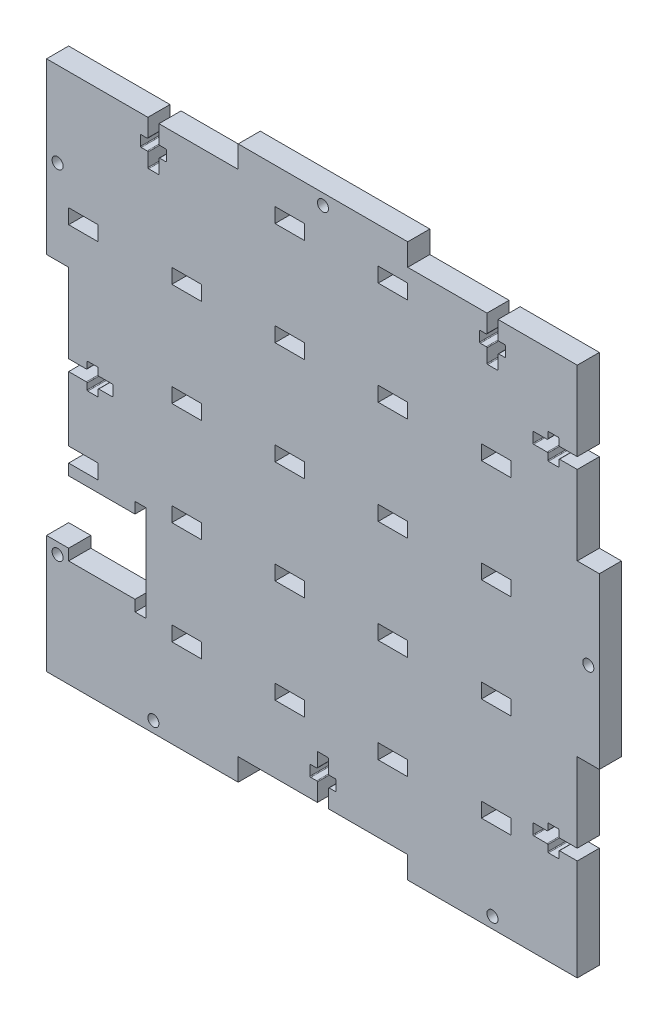
from build123d import *

# Parameters (mm, degrees)
BOX_SIDE_DEPTH       = 6
SKETCH2_R            = 1.5
SCREW_CUT_OUTS_DEPTH = 107.235587258
CUT_EXTRUDE1_DEPTH   = 107.235587258
SKETCH4_W            = 8
SKETCH4_H            = 4
CUT_EXTRUDE2_DEPTH   = 107.235587258


with BuildPart() as part:
    # Sketch1 → Box Side (new body)
    with BuildSketch(Plane.XY):
        Polygon((-69, 69), (-23, 69), (-23, 75), (23, 75), (23, 69), (69, 69), (69, 23), (75, 23), (75, -23), (69, -23), (69, -69), (69, -75), (23, -75), (23, -69), (-23, -69), (-23, -75), (-69, -75), (-75, -75), (-75, -69), (-75, -23), (-69, -23), (-69, 23), (-75, 23), (-75, 69), align=None)
    extrude(amount=BOX_SIDE_DEPTH)

    # Sketch2 → Screw Cut-outs (cut, through all)
    with BuildSketch(Plane.XY.offset(6)):
        with Locations((0, 72)):
            Circle(SKETCH2_R)
        with Locations((72, 0)):
            Circle(SKETCH2_R)
        with Locations((-46, -72)):
            Circle(SKETCH2_R)
        with Locations((46, -72)):
            Circle(SKETCH2_R)
        with Locations((-72, 46)):
            Circle(SKETCH2_R)
        with Locations((-72, -46)):
            Circle(SKETCH2_R)
        with BuildLine():
            Line((-44.5, 69), (-44.5, 64.2))
            ThreePointArc((-44.5, 64.2), (-44.441421356, 64.058578644), (-44.3, 64))
            Line((-44.3, 64), (-42.7, 64))
            ThreePointArc((-42.7, 64), (-42.558578644, 63.941421356), (-42.5, 63.8))
            Line((-42.5, 63.8), (-42.5, 61.2))
            ThreePointArc((-42.5, 61.2), (-42.558578644, 61.058578644), (-42.7, 61))
            Line((-42.7, 61), (-44.3, 61))
            ThreePointArc((-44.3, 61), (-44.441421356, 60.941421356), (-44.5, 60.8))
            Line((-44.5, 60.8), (-44.5, 57.2))
            ThreePointArc((-44.5, 57.2), (-44.558578644, 57.058578644), (-44.7, 57))
            Line((-44.7, 57), (-47.3, 57))
            ThreePointArc((-47.3, 57), (-47.441421356, 57.058578644), (-47.5, 57.2))
            Line((-47.5, 57.2), (-47.5, 60.8))
            ThreePointArc((-47.5, 60.8), (-47.558578644, 60.941421356), (-47.7, 61))
            Line((-47.7, 61), (-49.3, 61))
            ThreePointArc((-49.3, 61), (-49.441421356, 61.058578644), (-49.5, 61.2))
            Line((-49.5, 61.2), (-49.5, 63.8))
            ThreePointArc((-49.5, 63.8), (-49.441421356, 63.941421356), (-49.3, 64))
            Line((-49.3, 64), (-47.7, 64))
            ThreePointArc((-47.7, 64), (-47.558578644, 64.058578644), (-47.5, 64.2))
            Line((-47.5, 64.2), (-47.5, 69))
            Line((-47.5, 69), (-44.5, 69))
        make_face()
        with BuildLine():
            Line((47.5, 69), (47.5, 64.2))
            ThreePointArc((47.5, 64.2), (47.558578644, 64.058578644), (47.7, 64))
            Line((47.7, 64), (49.3, 64))
            ThreePointArc((49.3, 64), (49.441421356, 63.941421356), (49.5, 63.8))
            Line((49.5, 63.8), (49.5, 61.2))
            ThreePointArc((49.5, 61.2), (49.441421356, 61.058578644), (49.3, 61))
            Line((49.3, 61), (47.7, 61))
            ThreePointArc((47.7, 61), (47.558578644, 60.941421356), (47.5, 60.8))
            Line((47.5, 60.8), (47.5, 57.2))
            ThreePointArc((47.5, 57.2), (47.441421356, 57.058578644), (47.3, 57))
            Line((47.3, 57), (44.7, 57))
            ThreePointArc((44.7, 57), (44.558578644, 57.058578644), (44.5, 57.2))
            Line((44.5, 57.2), (44.5, 60.8))
            ThreePointArc((44.5, 60.8), (44.441421356, 60.941421356), (44.3, 61))
            Line((44.3, 61), (42.7, 61))
            ThreePointArc((42.7, 61), (42.558578644, 61.058578644), (42.5, 61.2))
            Line((42.5, 61.2), (42.5, 63.8))
            ThreePointArc((42.5, 63.8), (42.558578644, 63.941421356), (42.7, 64))
            Line((42.7, 64), (44.3, 64))
            ThreePointArc((44.3, 64), (44.441421356, 64.058578644), (44.5, 64.2))
            Line((44.5, 64.2), (44.5, 69))
            Line((44.5, 69), (47.5, 69))
        make_face()
        with BuildLine():
            Line((69, 44.5), (64.2, 44.5))
            ThreePointArc((64.2, 44.5), (64.058578644, 44.441421356), (64, 44.3))
            Line((64, 44.3), (64, 42.7))
            ThreePointArc((64, 42.7), (63.941421356, 42.558578644), (63.8, 42.5))
            Line((63.8, 42.5), (61.2, 42.5))
            ThreePointArc((61.2, 42.5), (61.058578644, 42.558578644), (61, 42.7))
            Line((61, 42.7), (61, 44.3))
            ThreePointArc((61, 44.3), (60.941421356, 44.441421356), (60.8, 44.5))
            Line((60.8, 44.5), (57.2, 44.5))
            ThreePointArc((57.2, 44.5), (57.058578644, 44.558578644), (57, 44.7))
            Line((57, 44.7), (57, 47.3))
            ThreePointArc((57, 47.3), (57.058578644, 47.441421356), (57.2, 47.5))
            Line((57.2, 47.5), (60.8, 47.5))
            ThreePointArc((60.8, 47.5), (60.941421356, 47.558578644), (61, 47.7))
            Line((61, 47.7), (61, 49.3))
            ThreePointArc((61, 49.3), (61.058578644, 49.441421356), (61.2, 49.5))
            Line((61.2, 49.5), (63.8, 49.5))
            ThreePointArc((63.8, 49.5), (63.941421356, 49.441421356), (64, 49.3))
            Line((64, 49.3), (64, 47.7))
            ThreePointArc((64, 47.7), (64.058578644, 47.558578644), (64.2, 47.5))
            Line((64.2, 47.5), (69, 47.5))
            Line((69, 47.5), (69, 44.5))
        make_face()
        with BuildLine():
            Line((69, -47.5), (64.2, -47.5))
            ThreePointArc((64.2, -47.5), (64.058578644, -47.558578644), (64, -47.7))
            Line((64, -47.7), (64, -49.3))
            ThreePointArc((64, -49.3), (63.941421356, -49.441421356), (63.8, -49.5))
            Line((63.8, -49.5), (61.2, -49.5))
            ThreePointArc((61.2, -49.5), (61.058578644, -49.441421356), (61, -49.3))
            Line((61, -49.3), (61, -47.7))
            ThreePointArc((61, -47.7), (60.941421356, -47.558578644), (60.8, -47.5))
            Line((60.8, -47.5), (57.2, -47.5))
            ThreePointArc((57.2, -47.5), (57.058578644, -47.441421356), (57, -47.3))
            Line((57, -47.3), (57, -44.7))
            ThreePointArc((57, -44.7), (57.058578644, -44.558578644), (57.2, -44.5))
            Line((57.2, -44.5), (60.8, -44.5))
            ThreePointArc((60.8, -44.5), (60.941421356, -44.441421356), (61, -44.3))
            Line((61, -44.3), (61, -42.7))
            ThreePointArc((61, -42.7), (61.058578644, -42.558578644), (61.2, -42.5))
            Line((61.2, -42.5), (63.8, -42.5))
            ThreePointArc((63.8, -42.5), (63.941421356, -42.558578644), (64, -42.7))
            Line((64, -42.7), (64, -44.3))
            ThreePointArc((64, -44.3), (64.058578644, -44.441421356), (64.2, -44.5))
            Line((64.2, -44.5), (69, -44.5))
            Line((69, -44.5), (69, -47.5))
        make_face()
        with BuildLine():
            Line((-1.5, -69), (1.5, -69))
            Line((1.5, -69), (1.5, -64.2))
            ThreePointArc((1.5, -64.2), (1.558578644, -64.058578644), (1.7, -64))
            Line((1.7, -64), (3.3, -64))
            ThreePointArc((3.3, -64), (3.441421356, -63.941421356), (3.5, -63.8))
            Line((3.5, -63.8), (3.5, -61.2))
            ThreePointArc((3.5, -61.2), (3.441421356, -61.058578644), (3.3, -61))
            Line((3.3, -61), (1.7, -61))
            ThreePointArc((1.7, -61), (1.558578644, -60.941421356), (1.5, -60.8))
            Line((1.5, -60.8), (1.5, -57.2))
            ThreePointArc((1.5, -57.2), (1.441421356, -57.058578644), (1.3, -57))
            Line((1.3, -57), (-1.3, -57))
            ThreePointArc((-1.3, -57), (-1.441421356, -57.058578644), (-1.5, -57.2))
            Line((-1.5, -57.2), (-1.5, -60.8))
            ThreePointArc((-1.5, -60.8), (-1.558578644, -60.941421356), (-1.7, -61))
            Line((-1.7, -61), (-3.3, -61))
            ThreePointArc((-3.3, -61), (-3.441421356, -61.058578644), (-3.5, -61.2))
            Line((-3.5, -61.2), (-3.5, -63.8))
            ThreePointArc((-3.5, -63.8), (-3.441421356, -63.941421356), (-3.3, -64))
            Line((-3.3, -64), (-1.7, -64))
            ThreePointArc((-1.7, -64), (-1.558578644, -64.058578644), (-1.5, -64.2))
            Line((-1.5, -64.2), (-1.5, -69))
        make_face()
        with BuildLine():
            Line((-69, -1.5), (-64.2, -1.5))
            ThreePointArc((-64.2, -1.5), (-64.058578644, -1.558578644), (-64, -1.7))
            Line((-64, -1.7), (-64, -3.3))
            ThreePointArc((-64, -3.3), (-63.941421356, -3.441421356), (-63.8, -3.5))
            Line((-63.8, -3.5), (-61.2, -3.5))
            ThreePointArc((-61.2, -3.5), (-61.058578644, -3.441421356), (-61, -3.3))
            Line((-61, -3.3), (-61, -1.7))
            ThreePointArc((-61, -1.7), (-60.941421356, -1.558578644), (-60.8, -1.5))
            Line((-60.8, -1.5), (-57.2, -1.5))
            ThreePointArc((-57.2, -1.5), (-57.058578644, -1.441421356), (-57, -1.3))
            Line((-57, -1.3), (-57, 1.3))
            ThreePointArc((-57, 1.3), (-57.058578644, 1.441421356), (-57.2, 1.5))
            Line((-57.2, 1.5), (-60.8, 1.5))
            ThreePointArc((-60.8, 1.5), (-60.941421356, 1.558578644), (-61, 1.7))
            Line((-61, 1.7), (-61, 3.3))
            ThreePointArc((-61, 3.3), (-61.058578644, 3.441421356), (-61.2, 3.5))
            Line((-61.2, 3.5), (-63.8, 3.5))
            ThreePointArc((-63.8, 3.5), (-63.941421356, 3.441421356), (-64, 3.3))
            Line((-64, 3.3), (-64, 1.7))
            ThreePointArc((-64, 1.7), (-64.058578644, 1.558578644), (-64.2, 1.5))
            Line((-64.2, 1.5), (-69, 1.5))
            Line((-69, 1.5), (-69, -1.5))
        make_face()
    extrude(amount=-SCREW_CUT_OUTS_DEPTH, mode=Mode.SUBTRACT)

    # Sketch3 → Cut-Extrude1 (cut, through all)
    with BuildSketch(Plane.XY.offset(6)):
        Polygon((-51, -46), (-51, -49), (-48, -49), (-48, -23), (-51, -23), (-51, -26), (-69, -26), (-69, -23), (-75, -23), (-75, -43), (-69, -43), (-69, -46), align=None)
    extrude(amount=-CUT_EXTRUDE1_DEPTH, mode=Mode.SUBTRACT)

    # Sketch4 → Cut-Extrude2 (cut, through all)
    with BuildSketch(Plane.XY.offset(6)):
        with Locations((-37, 35)):
            Rectangle(SKETCH4_W, SKETCH4_H)
        with Locations((-65, 35)):
            Rectangle(SKETCH4_W, SKETCH4_H)
        with Locations((19, 35.283560436)):
            Rectangle(SKETCH4_W, SKETCH4_H)
        with Locations((-9, 35.283560436)):
            Rectangle(SKETCH4_W, SKETCH4_H)
        with Locations((-9, 63.283560436)):
            Rectangle(SKETCH4_W, SKETCH4_H)
        with Locations((19, 63.283560436)):
            Rectangle(SKETCH4_W, SKETCH4_H)
        with Locations((47, 35.567120872)):
            Rectangle(SKETCH4_W, SKETCH4_H)
        with Locations((19, -20.716439564)):
            Rectangle(SKETCH4_W, SKETCH4_H)
        with Locations((-9, -20.716439564)):
            Rectangle(SKETCH4_W, SKETCH4_H)
        with Locations((-9, 7.283560436)):
            Rectangle(SKETCH4_W, SKETCH4_H)
        with Locations((19, 7.283560436)):
            Rectangle(SKETCH4_W, SKETCH4_H)
        with Locations((47, -20.432879128)):
            Rectangle(SKETCH4_W, SKETCH4_H)
        with Locations((47, 7.567120872)):
            Rectangle(SKETCH4_W, SKETCH4_H)
        with Locations((-9, -48.716439564)):
            Rectangle(SKETCH4_W, SKETCH4_H)
        with Locations((19, -48.716439564)):
            Rectangle(SKETCH4_W, SKETCH4_H)
        with Locations((47, -48.432879128)):
            Rectangle(SKETCH4_W, SKETCH4_H)
        with Locations((-37, -21)):
            Rectangle(SKETCH4_W, SKETCH4_H)
        with Locations((-65, -21)):
            Rectangle(SKETCH4_W, SKETCH4_H)
        with Locations((-37, 7)):
            Rectangle(SKETCH4_W, SKETCH4_H)
        with Locations((-37, -49)):
            Rectangle(SKETCH4_W, SKETCH4_H)
    extrude(amount=-CUT_EXTRUDE2_DEPTH, mode=Mode.SUBTRACT)


solid = part.part
